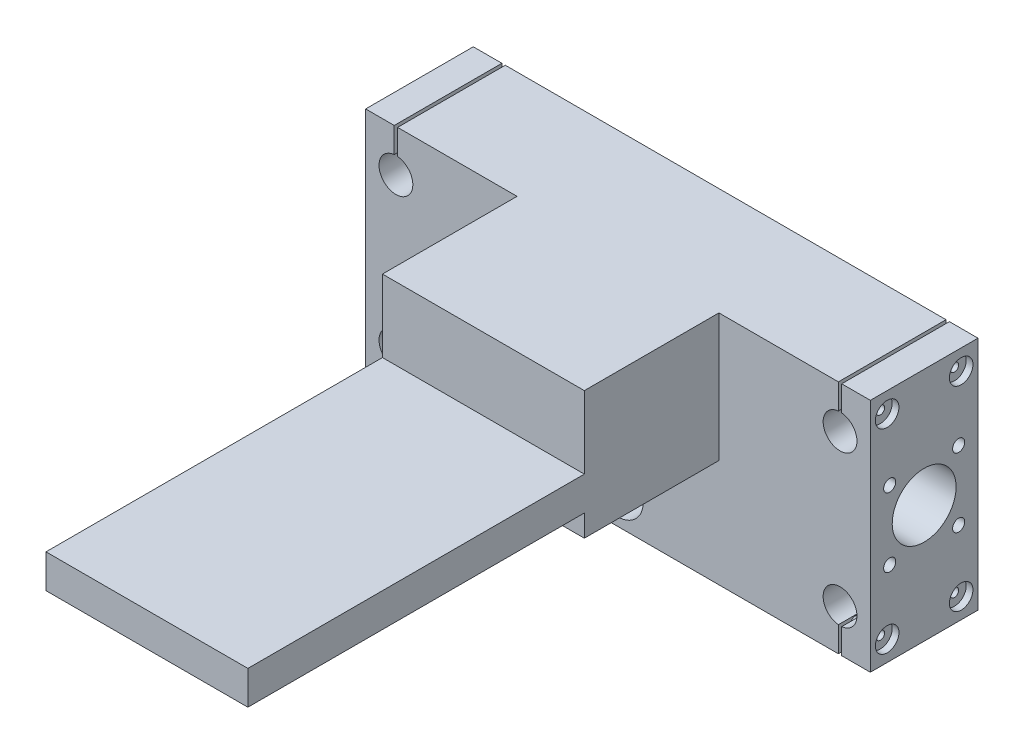
from build123d import *

# Parameters (mm, degrees)
SKETCH1_W                      = 150
SKETCH1_H                      = 70
BOSS_EXTRUDE1_DEPTH            = 32
SKETCH2_R                      = 9.5
LINEAR_BEARING_CUT_1_DEPTH     = 55
Y_AXIS_SHAFTS_CUT_DEPTH        = 169.594187326
LINEAR_BEARING_CUT_2_START     = -55
SKETCH7_R                      = 9.5
LINEAR_BEARING_CUT_2_DEPTH     = 55
SKETCH6_R                      = 6
BETWEEN_BEARINGS_DEPTH         = 123.266103234
SKETCH8_R                      = 3.5
SHAFT_HOLDER_SCREW_CUT_DEPTH   = 4
SKETCH9_R                      = 1.25
SHAFT_HOLDER_SCREW_CUT2_DEPTH  = 20
SHAFT_HOLDER_SCREW_CUT_3_START = -2
SKETCH10_R                     = 3.5
SHAFT_HOLDER_SCREW_CUT_3_DEPTH = 2
SHAFT_HOLDER_SCREW_CUT_4_START = -20
SKETCH11_R                     = 1.25
SHAFT_HOLDER_SCREW_CUT_4_DEPTH = 20
SKETCH12_R                     = 1.8
LINEAR_BEARING_SREW1_DEPTH     = 14
SKETCH13_R                     = 1.85
LINEAR_BEARING_SCREW2_DEPTH    = 14
SKETCH14_R                     = 7.5
CUT_EXTRUDE1_DEPTH             = 169.594187326
SKETCH16_W                     = 60
SKETCH16_H                     = 38
BOSS_EXTRUDE3_DEPTH            = 40
SKETCH17_W                     = 60
SKETCH17_H                     = 10
BOSS_EXTRUDE4_DEPTH            = 100


with BuildPart() as part:
    # Sketch1 → Boss-Extrude1 (new body)
    with BuildSketch(Plane.XY):
        with Locations((-75, -35)):
            Rectangle(SKETCH1_W, SKETCH1_H)
    extrude(amount=BOSS_EXTRUDE1_DEPTH)

    # Sketch2 → Linear_bearing-cut-1 (cut)
    with BuildSketch(Plane.ZY.offset(150)):
        with Locations((16, -35)):
            Circle(SKETCH2_R)
    extrude(amount=-LINEAR_BEARING_CUT_1_DEPTH, mode=Mode.SUBTRACT)

    # Sketch5 → Y-axis-shafts-cut (cut, through all)
    with BuildSketch(Plane.XY.offset(32)):
        with BuildLine():
            Line((-141.5, 0), (-141.5, -7.5))
            ThreePointArc((-141.5, -7.5), (-141, -17.524937811), (-140.5, -7.5))
            Line((-140.5, -7.5), (-140.5, 0))
            Line((-140.5, 0), (-141.5, 0))
        make_face()
        with BuildLine():
            Line((-8.5, 0), (-8.5, -7.5))
            ThreePointArc((-8.5, -7.5), (-9, -17.524937811), (-9.5, -7.5))
            Line((-9.5, -7.5), (-9.5, 0))
            Line((-9.5, 0), (-8.5, 0))
        make_face()
        with BuildLine():
            Line((-141.5, -70), (-141.5, -62.5))
            ThreePointArc((-141.5, -62.5), (-141, -52.475062189), (-140.5, -62.5))
            Line((-140.5, -62.5), (-140.5, -70))
            Line((-140.5, -70), (-141.5, -70))
        make_face()
        with BuildLine():
            Line((-9.5, -70), (-9.5, -62.5))
            ThreePointArc((-9.5, -62.5), (-9, -52.475062189), (-8.5, -62.5))
            Line((-8.5, -62.5), (-8.5, -70))
            Line((-8.5, -70), (-9.5, -70))
        make_face()
    extrude(amount=-Y_AXIS_SHAFTS_CUT_DEPTH, mode=Mode.SUBTRACT)

    # Sketch7 → Linear-bearing-cut-2 (cut)
    with BuildSketch(Plane(origin=(0, 0, 0), x_dir=(0, 0, -1), z_dir=(1, 0, 0)).offset(LINEAR_BEARING_CUT_2_START)):
        with Locations((-16, -35)):
            Circle(SKETCH7_R)
    extrude(amount=LINEAR_BEARING_CUT_2_DEPTH, mode=Mode.SUBTRACT)

    # Sketch6 → between-bearings (cut, through all)
    with BuildSketch(Plane.ZY.offset(95)):
        with Locations((16, -35)):
            Circle(SKETCH6_R)
    extrude(amount=-BETWEEN_BEARINGS_DEPTH, mode=Mode.SUBTRACT)

    # Sketch8 → shaft-holder-screw-cut (cut)
    with BuildSketch(Plane.ZY.offset(150)):
        with Locations((5, -6)):
            Circle(SKETCH8_R)
        with Locations((27, -6)):
            Circle(SKETCH8_R)
        with Locations((27, -64)):
            Circle(SKETCH8_R)
        with Locations((5, -64)):
            Circle(SKETCH8_R)
    extrude(amount=-SHAFT_HOLDER_SCREW_CUT_DEPTH, mode=Mode.SUBTRACT)

    # Sketch9 → shaft-holder-screw-cut2 (cut)
    with BuildSketch(Plane.ZY.offset(146)):
        with Locations((5, -6)):
            Circle(SKETCH9_R)
        with Locations((27, -6)):
            Circle(SKETCH9_R)
        with Locations((5, -64)):
            Circle(SKETCH9_R)
        with Locations((27, -64)):
            Circle(SKETCH9_R)
    extrude(amount=-SHAFT_HOLDER_SCREW_CUT2_DEPTH, mode=Mode.SUBTRACT)

    # Sketch10 → shaft-holder-screw-cut-3 (cut)
    with BuildSketch(Plane(origin=(0, 0, 0), x_dir=(0, 0, -1), z_dir=(1, 0, 0)).offset(SHAFT_HOLDER_SCREW_CUT_3_START)):
        with Locations((-27, -6)):
            Circle(SKETCH10_R)
        with Locations((-5, -6)):
            Circle(SKETCH10_R)
        with Locations((-5, -64)):
            Circle(SKETCH10_R)
        with Locations((-27, -64)):
            Circle(SKETCH10_R)
    extrude(amount=SHAFT_HOLDER_SCREW_CUT_3_DEPTH, mode=Mode.SUBTRACT)

    # Sketch11 → shaft-holder-screw-cut-4 (cut)
    with BuildSketch(Plane(origin=(-2, 0, 0), x_dir=(0, 0, -1), z_dir=(1, 0, 0)).offset(SHAFT_HOLDER_SCREW_CUT_4_START)):
        with Locations((-27, -6)):
            Circle(SKETCH11_R)
        with Locations((-5, -6)):
            Circle(SKETCH11_R)
        with Locations((-5, -64)):
            Circle(SKETCH11_R)
        with Locations((-27, -64)):
            Circle(SKETCH11_R)
    extrude(amount=SHAFT_HOLDER_SCREW_CUT_4_DEPTH, mode=Mode.SUBTRACT)

    # Sketch12 → Linear-bearing-srew1 (cut)
    with BuildSketch(Plane(origin=(0, 0, 0), x_dir=(0, 0, -1), z_dir=(1, 0, 0))):
        with Locations((-5.75, -24.75)):
            Circle(SKETCH12_R)
        with Locations((-26.25, -24.75)):
            Circle(SKETCH12_R)
        with Locations((-5.75, -45.25)):
            Circle(SKETCH12_R)
        with Locations((-26.25, -45.25)):
            Circle(SKETCH12_R)
    extrude(amount=-LINEAR_BEARING_SREW1_DEPTH, mode=Mode.SUBTRACT)

    # Sketch13 → Linear-bearing-screw2 (cut)
    with BuildSketch(Plane.ZY.offset(150)):
        with Locations((27.5, -24.75)):
            Circle(SKETCH13_R)
        with Locations((4.5, -24.75)):
            Circle(SKETCH13_R)
        with Locations((27.5, -45.25)):
            Circle(SKETCH13_R)
        with Locations((4.5, -45.25)):
            Circle(SKETCH13_R)
    extrude(amount=-LINEAR_BEARING_SCREW2_DEPTH, mode=Mode.SUBTRACT)

    # Sketch14 → Cut-Extrude1 (cut, through all)
    with BuildSketch(Plane.XY.offset(32)):
        with Locations((-75, -60)):
            Circle(SKETCH14_R)
    extrude(amount=-CUT_EXTRUDE1_DEPTH, mode=Mode.SUBTRACT)

    # Sketch16 → Boss-Extrude3 (add)
    with BuildSketch(Plane.XY.offset(32)):
        with Locations((-75, -19)):
            Rectangle(SKETCH16_W, SKETCH16_H)
    extrude(amount=BOSS_EXTRUDE3_DEPTH)

    # Sketch17 → Boss-Extrude4 (add)
    with BuildSketch(Plane.XY.offset(72)):
        with Locations((-75, -26.5)):
            Rectangle(SKETCH17_W, SKETCH17_H)
    extrude(amount=BOSS_EXTRUDE4_DEPTH)


solid = part.part
